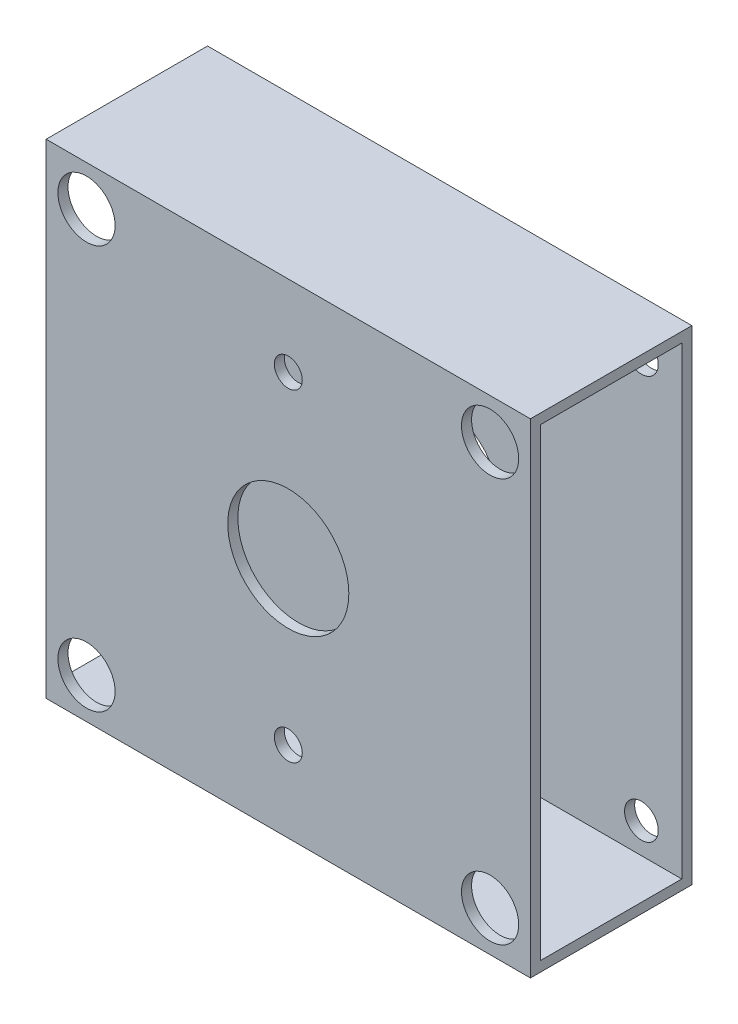
from build123d import *

# Parameters (mm, degrees)
SKETCH1_W                                       = 76.2
SKETCH1_H                                       = 76.2
BOSS_EXTRUDE1_DEPTH                             = 12.7
SKETCH2_W                                       = 22.225
SKETCH2_H                                       = 73.025
CUT_EXTRUDE1_DEPTH                              = 87.135590786
SKETCH4_R                                       = 9.525
SKETCH4_R_2                                     = 2.2
SKETCH4_R_3                                     = 2.368967754
SKETCH4_R_4                                     = 2.114206927
SKETCH4_R_5                                     = 2.315385773
SKETCH4_R_6                                     = 1.799630575
CUT_EXTRUDE2_DEPTH                              = 60.56828015
CBORE_FOR_M5_SOCKET_HEAD_CAP_SCREW1_D           = 5.3
CBORE_FOR_M5_SOCKET_HEAD_CAP_SCREW1_CBORE_D     = 9
CBORE_FOR_M5_SOCKET_HEAD_CAP_SCREW1_CBORE_DEPTH = 5.4
CUT_EXTRUDE3_REACH                              = 61.568
SKETCH8_R                                       = 3.81


with BuildPart() as part:
    # Sketch1 → Boss-Extrude1 (new, symmetric)
    with BuildSketch(Plane.XY):
        Rectangle(SKETCH1_W, SKETCH1_H)
    extrude(amount=BOSS_EXTRUDE1_DEPTH, both=True)

    # Sketch2 → Cut-Extrude1 (cut, through all)
    with BuildSketch(Plane(origin=(38.1, 0, 0), x_dir=(0, 0, -1), z_dir=(1, 0, 0))):
        Rectangle(SKETCH2_W, SKETCH2_H)
    extrude(amount=-CUT_EXTRUDE1_DEPTH, mode=Mode.SUBTRACT)

    # Sketch4 → Cut-Extrude2 (cut, through all)
    with BuildSketch(Plane.XY.offset(12.7)):
        Circle(SKETCH4_R)
        with Locations((0, 25.4)):
            Circle(SKETCH4_R_2)
        with Locations((-31.75, 31.75)):
            Circle(SKETCH4_R_3)
        with Locations((31.75, 31.75)):
            Circle(SKETCH4_R_4)
        with Locations((-31.75, -31.75)):
            Circle(SKETCH4_R_5)
        with Locations((31.75, -31.75)):
            Circle(SKETCH4_R_6)
        with Locations((0, -25.4)):
            Circle(SKETCH4_R_2)
    extrude(amount=-CUT_EXTRUDE2_DEPTH, mode=Mode.SUBTRACT)

    # CBORE for M5 Socket Head Cap Screw1 (through all)
    with Locations(Plane.XY.offset(12.7)):
        with Locations((-31.75, 31.75), (31.75, 31.75), (31.75, -31.75), (-31.75, -31.75)):
            CounterBoreHole(CBORE_FOR_M5_SOCKET_HEAD_CAP_SCREW1_D / 2, CBORE_FOR_M5_SOCKET_HEAD_CAP_SCREW1_CBORE_D / 2, CBORE_FOR_M5_SOCKET_HEAD_CAP_SCREW1_CBORE_DEPTH)

    # Sketch8 → Cut-Extrude3 (cut, up to next)
    with BuildSketch(Plane(origin=(0, 0, -12.7), x_dir=(-1, 0, 0), z_dir=(0, 0, -1)), mode=Mode.PRIVATE) as cut_extrude3_sk1:
        with Locations((0, 25.4)):
            Circle(SKETCH8_R)
    cut_extrude3_tool1 = extrude(cut_extrude3_sk1.sketch, amount=-CUT_EXTRUDE3_REACH, mode=Mode.PRIVATE) & part.part
    # Sketch8 → Cut-Extrude3 (cut, up to next)
    with BuildSketch(Plane(origin=(0, 0, -12.7), x_dir=(-1, 0, 0), z_dir=(0, 0, -1)), mode=Mode.PRIVATE) as cut_extrude3_sk2:
        with Locations((0, -25.4)):
            Circle(SKETCH8_R)
    cut_extrude3_tool2 = extrude(cut_extrude3_sk2.sketch, amount=-CUT_EXTRUDE3_REACH, mode=Mode.PRIVATE) & part.part
    add(cut_extrude3_tool1.solids().sort_by_distance((0, 25.4, -12.7))[0], mode=Mode.SUBTRACT)
    add(cut_extrude3_tool2.solids().sort_by_distance((0, -25.4, -12.7))[0], mode=Mode.SUBTRACT)


solid = part.part
